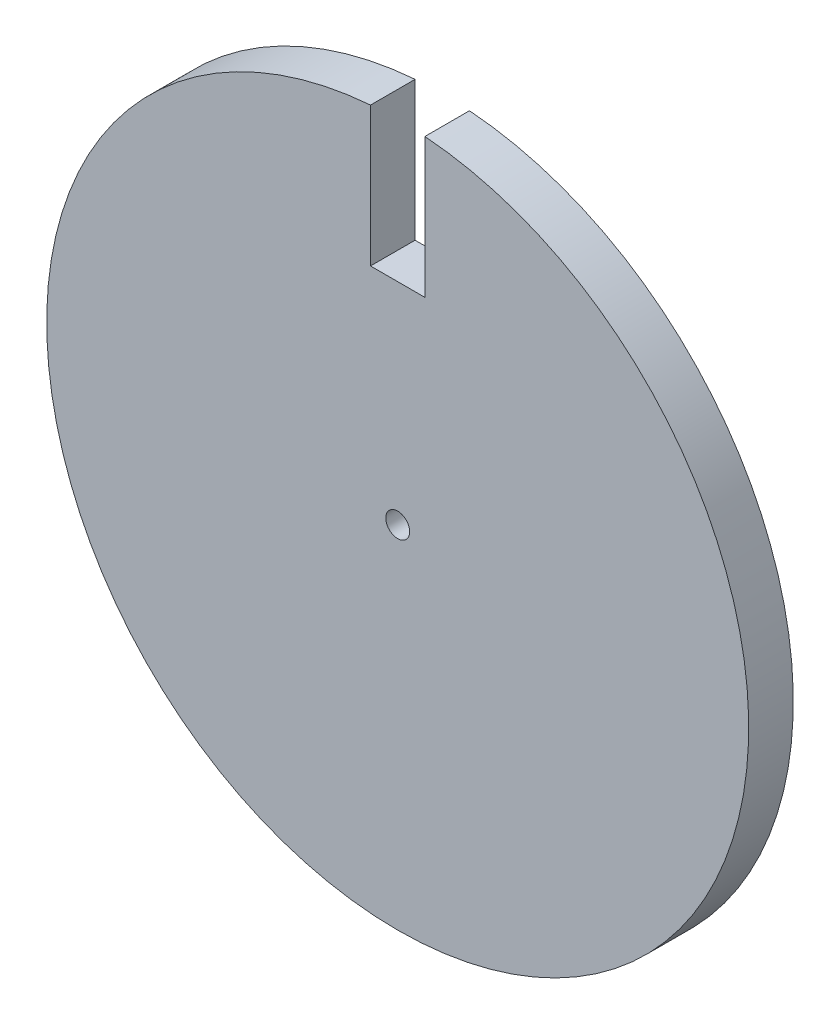
from build123d import *

# Parameters (mm, degrees)
SKETCH1_R           = 25
SKETCH1_R_2         = 0.85
BOSS_EXTRUDE1_DEPTH = 1.5875
CUT_EXTRUDE1_REACH  = 37.498
SKETCH2_W           = 3.873993702
SKETCH2_H           = 19.044786736


with BuildPart() as part:
    # Sketch1 → Boss-Extrude1 (new, symmetric)
    with BuildSketch(Plane.XY):
        Circle(SKETCH1_R)
        Circle(SKETCH1_R_2, mode=Mode.SUBTRACT)
    extrude(amount=BOSS_EXTRUDE1_DEPTH, both=True)

    # Sketch2 → Cut-Extrude1 (cut, up to next)
    with BuildSketch(Plane(origin=(0, 0, -1.5875), x_dir=(-1, 0, 0), z_dir=(0, 0, -1)), mode=Mode.PRIVATE) as cut_extrude1_sk1:
        with Locations((0, 24.522393368)):
            Rectangle(SKETCH2_W, SKETCH2_H)
    cut_extrude1_tool1 = extrude(cut_extrude1_sk1.sketch, amount=-CUT_EXTRUDE1_REACH, mode=Mode.PRIVATE) & part.part
    add(cut_extrude1_tool1.solids().sort_by_distance((0, 24.522393, -1.5875))[0], mode=Mode.SUBTRACT)


solid = part.part
